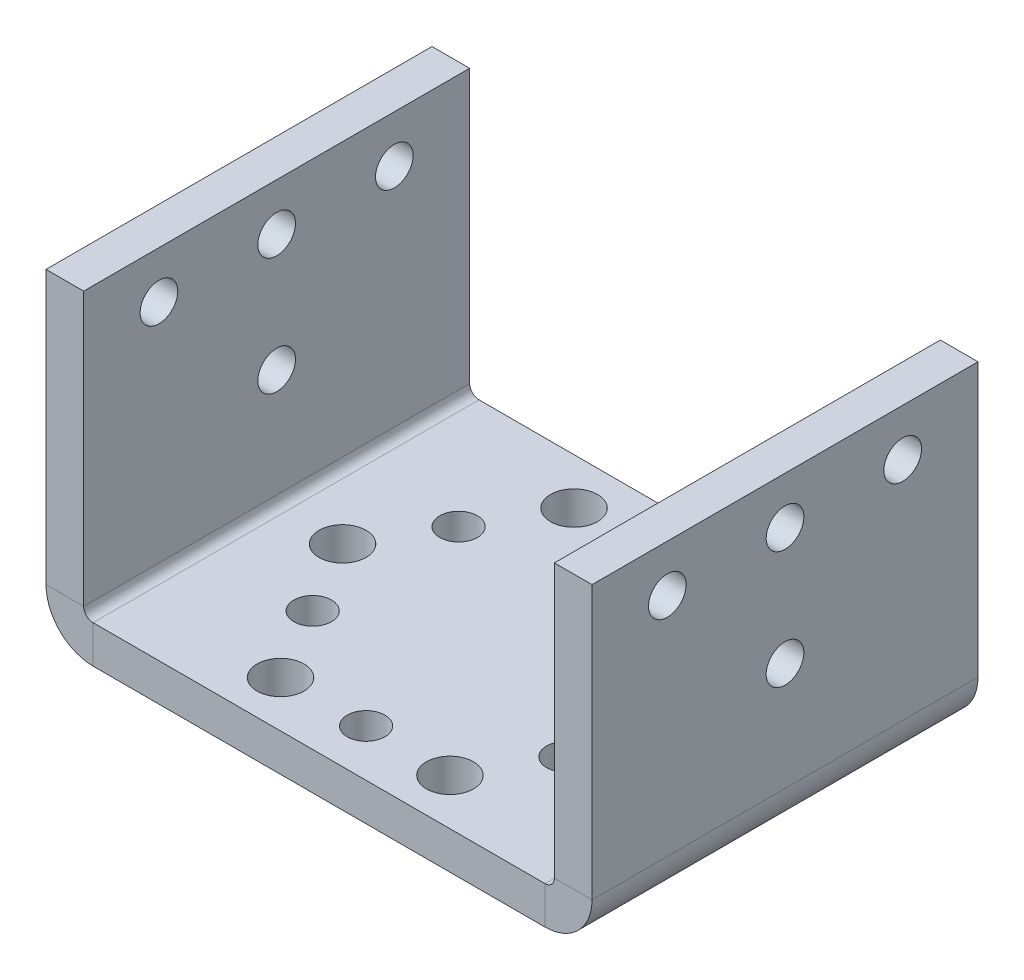
from build123d import *

# Parameters (mm, degrees)
SM_BASE_FLANGE_1_DEPTH   = 41
SKETCH_9_R               = 2.5
SKETCH_9_R_2             = 2
CUT_EXTRUDE_4_DEPTH      = 61.6465168
CUT_EXTRUDE_5_DEPTH      = 78.103826105
CUT_EXTRUDE_5_DEPTH_BACK = 78.103826105
SKETCH_10_R              = 2


# Sheet-metal steps are written as plain solids
with BuildPart() as part:
    # Sketch 1 → Базовая кромка1 (new body)
    with BuildSketch(Plane.XY):
        with BuildLine():
            Line((-25, 30), (-25, 1))
            ThreePointArc((-25, 1), (-24.707106781, 0.292893219), (-24, 0))
            Line((-24, 0), (24, 0))
            ThreePointArc((24, 0), (24.707106781, 0.292893219), (25, 1))
            Line((25, 1), (25, 30))
            Line((25, 30), (29, 30))
            Line((29, 30), (29, 1))
            ThreePointArc((29, 1), (27.535533906, -2.535533906), (24, -4))
            Line((24, -4), (-24, -4))
            ThreePointArc((-24, -4), (-27.535533906, -2.535533906), (-29, 1))
            Line((-29, 1), (-29, 30))
            Line((-29, 30), (-25, 30))
        make_face()
    extrude(amount=SM_BASE_FLANGE_1_DEPTH)

    # Эскиз9 → Вырез-Вытянуть4 (cut, through all)
    with BuildSketch(Plane.XZ.offset(4)):
        with Locations((-18, 20.5)):
            Circle(SKETCH_9_R)
        with Locations((-9, 36.088457268)):
            Circle(SKETCH_9_R)
        with Locations((9, 36.088457268)):
            Circle(SKETCH_9_R)
        with Locations((18, 20.5)):
            Circle(SKETCH_9_R)
        with Locations((9, 4.911542732)):
            Circle(SKETCH_9_R)
        with Locations((-9, 4.911542732)):
            Circle(SKETCH_9_R)
        with Locations((0, 5)):
            Circle(SKETCH_9_R_2)
        with Locations((-13.423393759, 12.75)):
            Circle(SKETCH_9_R_2)
        with Locations((-13.423393759, 28.25)):
            Circle(SKETCH_9_R_2)
        with Locations((0, 36)):
            Circle(SKETCH_9_R_2)
        with Locations((13.423393759, 28.25)):
            Circle(SKETCH_9_R_2)
        with Locations((13.423393759, 12.75)):
            Circle(SKETCH_9_R_2)
    extrude(amount=-CUT_EXTRUDE_4_DEPTH, mode=Mode.SUBTRACT)

    # Эскиз10 → Вырез-Вытянуть5 (cut, two sides: drawn at the far end of the back side and taken through both)
    with BuildSketch(Plane(origin=(29, 0, 0), x_dir=(0, 0, -1), z_dir=(1, 0, 0)).offset(-CUT_EXTRUDE_5_DEPTH_BACK)):
        with Locations((-33, 25)):
            Circle(SKETCH_10_R)
        with Locations((-20.5, 25)):
            Circle(SKETCH_10_R)
        with Locations((-8, 25)):
            Circle(SKETCH_10_R)
        with Locations((-20.5, 12.5)):
            Circle(SKETCH_10_R)
    extrude(amount=CUT_EXTRUDE_5_DEPTH + CUT_EXTRUDE_5_DEPTH_BACK, mode=Mode.SUBTRACT)


solid = part.part
